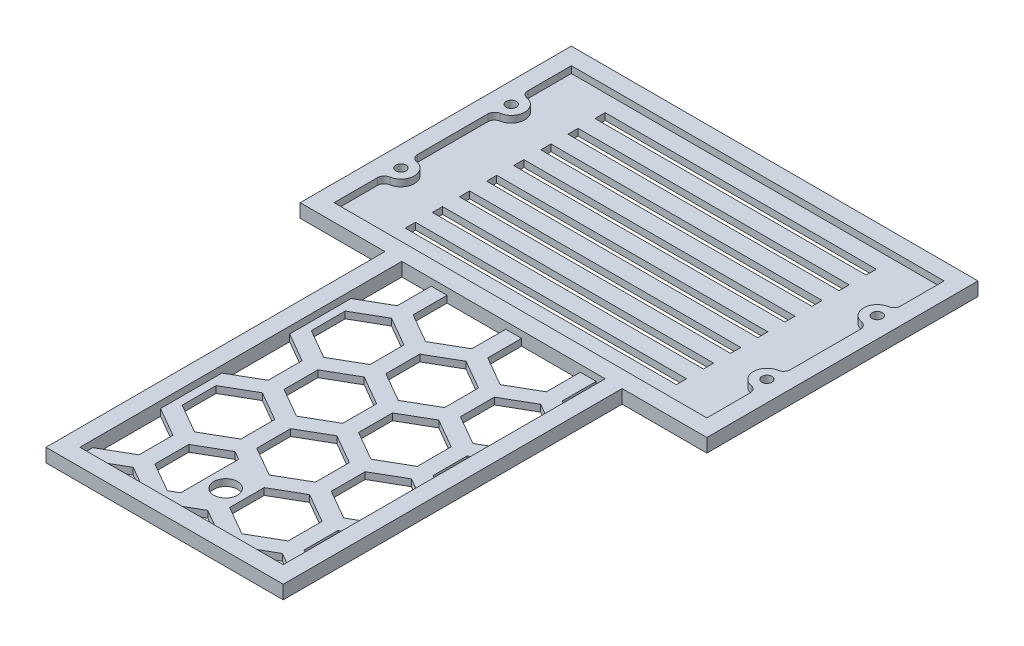
from build123d import *

# Parameters (mm, degrees)
BOSS_EXTRUDE1_OUTLINE_R = 1.5
BOSS_EXTRUDE1_OUTLINE_W = 80
BOSS_EXTRUDE1_OUTLINE_H = 3
BOSS_EXTRUDE1_DEPTH     = 2
SKETCH2_W               = 60
SKETCH2_H               = 95
SKETCH2_R               = 1.5
BOSS_EXTRUDE2_DEPTH     = 2
SKETCH3_R               = 3.5
CUT_EXTRUDE1_DEPTH      = 6


# Read off the part's stored shape, not the designer's step: Boss-Extrude1
with BuildPart() as part:
    # Boss-Extrude1 outline → Boss-Extrude1 (new body)
    with BuildSketch(Plane(origin=(0, 0, 0), x_dir=(1, 0, 0), z_dir=(0, 1, 0))):
        Polygon((-60, -40), (-35, -40), (-35, -140), (35, -140), (35, -40), (60, -40), (60, 40), (-60, 40), align=None)
        Polygon((-10.794919243, -135), (-27.205080757, -135), (-19, -130.262794416), align=None, mode=Mode.SUBTRACT)
        Polygon((-21.339745962, -126.210235533), (-30, -131.210235533), (-30, -111.210235533), (-21.339745962, -116.210235533), align=None, mode=Mode.SUBTRACT)
        Polygon((-16.660254038, -116.210235533), (-8, -111.210235533), (-5.5, -112.653611206), (-5.5, -129.76685986), (-8, -131.210235533), (-16.660254038, -126.210235533), align=None, mode=Mode.SUBTRACT)
        Polygon((-10.339745962, -107.15767665), (-19, -112.15767665), (-27.660254038, -107.15767665), (-27.660254038, -97.15767665), (-19, -92.15767665), (-10.339745962, -97.15767665), align=None, mode=Mode.SUBTRACT)
        Polygon((-21.339745962, -88.105117767), (-30, -93.105117767), (-30, -73.105117767), (-21.339745962, -78.105117767), align=None, mode=Mode.SUBTRACT)
        Polygon((0.660254038, -88.105117767), (-8, -93.105117767), (-16.660254038, -88.105117767), (-16.660254038, -78.105117767), (-8, -73.105117767), (0.660254038, -78.105117767), align=None, mode=Mode.SUBTRACT)
        Polygon((-10.339745962, -69.052558883), (-19, -74.052558883), (-27.660254038, -69.052558883), (-27.660254038, -59.052558883), (-19, -54.052558883), (-10.339745962, -59.052558883), align=None, mode=Mode.SUBTRACT)
        Polygon((3, -130.262794416), (11.205080757, -135), (-5.205080757, -135), align=None, mode=Mode.SUBTRACT)
        Polygon((14, -131.210235533), (5.5, -126.302758245), (5.5, -116.117712821), (14, -111.210235533), (22.660254038, -116.210235533), (22.660254038, -126.210235533), align=None, mode=Mode.SUBTRACT)
        Polygon((16.794919243, -135), (25, -130.262794416), (30, -133.149545762), (30, -135), align=None, mode=Mode.SUBTRACT)
        Polygon((27.339745962, -126.210235533), (27.339745962, -116.210235533), (30, -114.674337148), (30, -127.746133918), align=None, mode=Mode.SUBTRACT)
        Polygon((11.660254038, -97.15767665), (11.660254038, -107.15767665), (3, -112.15767665), (-5.660254038, -107.15767665), (-5.660254038, -97.15767665), (3, -92.15767665), align=None, mode=Mode.SUBTRACT)
        Polygon((16.339745962, -97.15767665), (25, -92.15767665), (30, -95.044427996), (30, -109.270925304), (25, -112.15767665), (16.339745962, -107.15767665), align=None, mode=Mode.SUBTRACT)
        Polygon((22.660254038, -88.105117767), (14, -93.105117767), (5.339745962, -88.105117767), (5.339745962, -78.105117767), (14, -73.105117767), (22.660254038, -78.105117767), align=None, mode=Mode.SUBTRACT)
        Polygon((27.339745962, -88.105117767), (27.339745962, -78.105117767), (30, -76.569219382), (30, -89.641016151), align=None, mode=Mode.SUBTRACT)
        Polygon((11.660254038, -69.052558883), (3, -74.052558883), (-5.660254038, -69.052558883), (-5.660254038, -59.052558883), (3, -54.052558883), (11.660254038, -59.052558883), align=None, mode=Mode.SUBTRACT)
        Polygon((16.339745962, -59.052558883), (25, -54.052558883), (30, -56.939310229), (30, -71.165807537), (25, -74.052558883), (16.339745962, -69.052558883), align=None, mode=Mode.SUBTRACT)
        with Locations((-54, -16.28)):
            Circle(BOSS_EXTRUDE1_OUTLINE_R, mode=Mode.SUBTRACT)
        Polygon((-30, -55), (-30, -40), (-21.339745962, -40), (-21.339745962, -50), align=None, mode=Mode.SUBTRACT)
        Polygon((-8, -55), (-16.660254038, -50), (-16.660254038, -40), (0.660254038, -40), (0.660254038, -50), align=None, mode=Mode.SUBTRACT)
        with Locations((-54, 16.27)):
            Circle(BOSS_EXTRUDE1_OUTLINE_R, mode=Mode.SUBTRACT)
        Polygon((22.660254038, -50), (14, -55), (5.339745962, -50), (5.339745962, -40), (22.660254038, -40), align=None, mode=Mode.SUBTRACT)
        Polygon((27.339745962, -40), (30, -40), (30, -51.535898385), (27.339745962, -50), align=None, mode=Mode.SUBTRACT)
        with Locations((0, -27.5)):
            Rectangle(BOSS_EXTRUDE1_OUTLINE_W, BOSS_EXTRUDE1_OUTLINE_H, mode=Mode.SUBTRACT)
        with Locations((0, -19.5)):
            Rectangle(BOSS_EXTRUDE1_OUTLINE_W, BOSS_EXTRUDE1_OUTLINE_H, mode=Mode.SUBTRACT)
        with Locations((0, -11.5)):
            Rectangle(BOSS_EXTRUDE1_OUTLINE_W, BOSS_EXTRUDE1_OUTLINE_H, mode=Mode.SUBTRACT)
        with Locations((54, -16.28)):
            Circle(BOSS_EXTRUDE1_OUTLINE_R, mode=Mode.SUBTRACT)
        with Locations((0, -3.5)):
            Rectangle(BOSS_EXTRUDE1_OUTLINE_W, BOSS_EXTRUDE1_OUTLINE_H, mode=Mode.SUBTRACT)
        with Locations((0, 4.5)):
            Rectangle(BOSS_EXTRUDE1_OUTLINE_W, BOSS_EXTRUDE1_OUTLINE_H, mode=Mode.SUBTRACT)
        with Locations((0, 12.5)):
            Rectangle(BOSS_EXTRUDE1_OUTLINE_W, BOSS_EXTRUDE1_OUTLINE_H, mode=Mode.SUBTRACT)
        with Locations((0, 20.5)):
            Rectangle(BOSS_EXTRUDE1_OUTLINE_W, BOSS_EXTRUDE1_OUTLINE_H, mode=Mode.SUBTRACT)
        with Locations((0, 28.5)):
            Rectangle(BOSS_EXTRUDE1_OUTLINE_W, BOSS_EXTRUDE1_OUTLINE_H, mode=Mode.SUBTRACT)
        with Locations((54, 16.27)):
            Circle(BOSS_EXTRUDE1_OUTLINE_R, mode=Mode.SUBTRACT)
    extrude(amount=BOSS_EXTRUDE1_DEPTH)

    # Sketch2 → Boss-Extrude2 (add)
    with BuildSketch(Plane(origin=(0, 2, 0), x_dir=(1, 0, 0), z_dir=(0, 1, 0))):
        Polygon((-60, 0), (-60, -40), (-35, -40), (-35, -140), (35, -140), (35, -40), (60, -40), (60, 0), (60, 40), (-60, 40), align=None)
        with Locations((0, -87.5)):
            Rectangle(SKETCH2_W, SKETCH2_H, mode=Mode.SUBTRACT)
        with Locations((-54, -16.28)):
            Circle(SKETCH2_R, mode=Mode.SUBTRACT)
        with Locations((-54, 16.27)):
            Circle(SKETCH2_R, mode=Mode.SUBTRACT)
        with Locations((54, -16.28)):
            Circle(SKETCH2_R, mode=Mode.SUBTRACT)
        with BuildLine():
            Line((-30, -35), (-55, -35))
            Line((-55, -35), (-55, -22.196079783))
            ThreePointArc((-55, -22.196079783), (-54.527525232, -20.905085334), (-53.333333333, -20.224053189))
            ThreePointArc((-53.333333333, -20.224053189), (-50, -16.28), (-53.333333333, -12.335946811))
            ThreePointArc((-53.333333333, -12.335946811), (-54.527525232, -11.654914666), (-55, -10.363920217))
            Line((-55, -10.363920217), (-55, 0))
            Line((-55, 0), (-55, 10.353920217))
            ThreePointArc((-55, 10.353920217), (-54.527525232, 11.644914666), (-53.333333333, 12.325946811))
            ThreePointArc((-53.333333333, 12.325946811), (-50, 16.27), (-53.333333333, 20.214053189))
            ThreePointArc((-53.333333333, 20.214053189), (-54.527525232, 20.895085334), (-55, 22.186079783))
            Line((-55, 22.186079783), (-55, 35))
            Line((-55, 35), (55, 35))
            Line((55, 35), (55, 22.186079783))
            ThreePointArc((55, 22.186079783), (54.527525232, 20.895085334), (53.333333333, 20.214053189))
            ThreePointArc((53.333333333, 20.214053189), (50, 16.27), (53.333333333, 12.325946811))
            ThreePointArc((53.333333333, 12.325946811), (54.527525232, 11.644914666), (55, 10.353920217))
            Line((55, 10.353920217), (55, 0))
            Line((55, 0), (55, -10.363920217))
            ThreePointArc((55, -10.363920217), (54.527525232, -11.654914666), (53.333333333, -12.335946811))
            ThreePointArc((53.333333333, -12.335946811), (50, -16.28), (53.333333333, -20.224053189))
            ThreePointArc((53.333333333, -20.224053189), (54.527525232, -20.905085334), (55, -22.196079783))
            Line((55, -22.196079783), (55, -35))
            Line((55, -35), (30, -35))
            Line((30, -35), (-30, -35))
        make_face(mode=Mode.SUBTRACT)
        with Locations((54, 16.27)):
            Circle(SKETCH2_R, mode=Mode.SUBTRACT)
    extrude(amount=BOSS_EXTRUDE2_DEPTH)

    # Sketch3 → Cut-Extrude1 (cut)
    with BuildSketch(Plane(origin=(0, 2, 0), x_dir=(1, 0, 0), z_dir=(0, 1, 0))):
        with Locations(Location((0, -122, 0), (0, 0, 270))):
            Circle(SKETCH3_R)
    extrude(amount=-CUT_EXTRUDE1_DEPTH, mode=Mode.SUBTRACT)


solid = part.part
